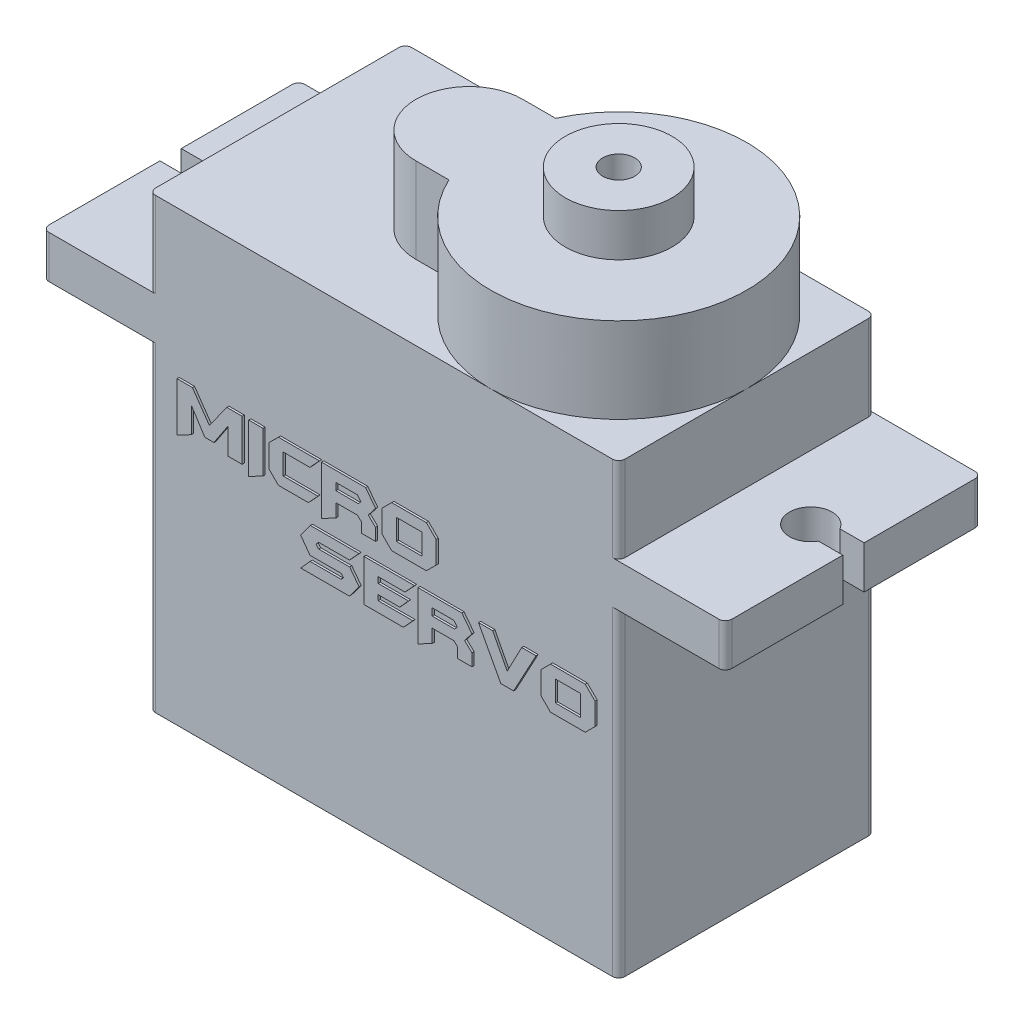
from build123d import *

# Parameters (mm, degrees)
SKETCH1_W           = 32
SKETCH1_H           = 12
BOSS_EXTRUDE1_DEPTH = 2
SKETCH2_W           = 22
SKETCH2_H           = 12
BOSS_EXTRUDE2_DEPTH = 15
SKETCH3_W           = 22
SKETCH3_H           = 12
BOSS_EXTRUDE3_DEPTH = 4
SKETCH4_R           = 6
BOSS_EXTRUDE4_DEPTH = 4
BOSS_EXTRUDE5_DEPTH = 4
SKETCH6_R           = 2.5
SKETCH6_R_2         = 0.75
BOSS_EXTRUDE6_DEPTH = 2
SKETCH7_R           = 1
SKETCH7_W           = 5
SKETCH7_H           = 1
CUT_EXTRUDE1_DEPTH  = 25.103941586
FILLET1_R           = 0.3
SKETCH8_W           = 1.18990991
SKETCH8_H           = 0.976336336
SKETCH8_H_2         = 0.976336337
BOSS_EXTRUDE7_DEPTH = 0.1


with BuildPart() as part:
    # Sketch1 → Boss-Extrude1 (new body)
    with BuildSketch(Plane(origin=(0, 0, 0), x_dir=(1, 0, 0), z_dir=(0, 1, 0))):
        Rectangle(SKETCH1_W, SKETCH1_H)
    extrude(amount=BOSS_EXTRUDE1_DEPTH)

    # Sketch2 → Boss-Extrude2 (add)
    with BuildSketch(Plane.XZ):
        Rectangle(SKETCH2_W, SKETCH2_H)
    extrude(amount=BOSS_EXTRUDE2_DEPTH)

    # Sketch3 → Boss-Extrude3 (add)
    with BuildSketch(Plane(origin=(0, 2, 0), x_dir=(1, 0, 0), z_dir=(0, 1, 0))):
        Rectangle(SKETCH3_W, SKETCH3_H)
    extrude(amount=BOSS_EXTRUDE3_DEPTH)

    # Sketch4 → Boss-Extrude4 (add)
    with BuildSketch(Plane(origin=(0, 6, 0), x_dir=(1, 0, 0), z_dir=(0, 1, 0))):
        with Locations((5, 0)):
            Circle(SKETCH4_R)
    extrude(amount=BOSS_EXTRUDE4_DEPTH)

    # Sketch5 → Boss-Extrude5 (add)
    with BuildSketch(Plane(origin=(0, 6, 0), x_dir=(1, 0, 0), z_dir=(0, 1, 0))):
        with BuildLine():
            ThreePointArc((-1, 0), (-0.862002062, 1.279426367), (-0.454356057, 2.5))
            Line((-0.454356057, 2.5), (-2, 2.5))
            ThreePointArc((-2, 2.5), (-4.5, 0), (-2, -2.5))
            Line((-2, -2.5), (-0.454356057, -2.5))
            ThreePointArc((-0.454356057, -2.5), (-0.862002062, -1.279426367), (-1, 0))
        make_face()
    extrude(amount=BOSS_EXTRUDE5_DEPTH)

    # Sketch6 → Boss-Extrude6 (add)
    with BuildSketch(Plane(origin=(0, 10, 0), x_dir=(1, 0, 0), z_dir=(0, 1, 0))):
        with Locations((5, 0)):
            Circle(SKETCH6_R)
        with Locations((5, 0)):
            Circle(SKETCH6_R_2, mode=Mode.SUBTRACT)
    extrude(amount=BOSS_EXTRUDE6_DEPTH)

    # Sketch7 → Cut-Extrude1 (cut, through all)
    with BuildSketch(Plane(origin=(0, 2, 0), x_dir=(1, 0, 0), z_dir=(0, 1, 0))):
        with Locations((14, 0)):
            Circle(SKETCH7_R)
        with Locations((-14, 0)):
            Circle(SKETCH7_R)
        with Locations((16, 0)):
            Rectangle(SKETCH7_W, SKETCH7_H)
        with Locations((-16, 0)):
            Rectangle(SKETCH7_W, SKETCH7_H)
    extrude(amount=-CUT_EXTRUDE1_DEPTH, mode=Mode.SUBTRACT)

    # Fillet1
    fillet1_edges = [part.edges().sort_by_distance(p)[0] for p in [
        (11, 4, -6),
        (11, -7.5, -6),
        (11, 4, 6),
        (11, -7.5, 6),
        (-11, 4, -6),
        (-11, 4, 6),
        (-11, -7.5, 6),
        (-11, -7.5, -6),
        (-16, 1, -6),
        (-16, 1, 6),
        (16, 1, -6),
        (16, 1, 6),
    ]]
    fillet(fillet1_edges, radius=FILLET1_R)

    # Sketch8 → Boss-Extrude7 (add)
    # profile 1 of 10: a face of its own
    with BuildSketch(Plane.XY.offset(6)):
        Polygon((-6.546228955, -2.789688189), (-7.217460186, -2.789688189), (-7.217460186, -1.581662663), (-7.868192168, -2.564673174), (-8.295339315, -2.564673174), (-8.926048774, -1.582616117), (-8.926048774, -2.775386387), (-9.597280006, -3.125303805), (-9.597280006, -0.837015516), (-8.876469195, -0.837015516), (-8.079858834, -1.98115966), (-7.268469946, -0.837015516), (-6.546228955, -0.837015516), align=None)
    # profile 2 of 10: a face of its own
    with BuildSketch(Plane.XY.offset(6)):
        Polygon((-5.569892618, -2.778246748), (-6.241123849, -3.125303805), (-6.241123849, -0.837015516), (-5.569892618, -0.837015516), align=None)
    # profile 3 of 10: a face of its own
    with BuildSketch(Plane.XY.offset(6)):
        Polygon((-2.923582558, -0.837015516), (-3.373135861, -1.325183685), (-4.624066792, -1.325183685), (-4.624066792, -2.301520021), (-2.99175448, -2.301520021), (-3.445121597, -2.789688189), (-4.84431454, -2.789688189), (-5.295298024, -2.344902153), (-5.295298024, -1.285138639), (-4.84431454, -0.837015516), align=None)
    # profile 4 of 10: a face of its own
    with BuildSketch(Plane.XY.offset(6)):
        Polygon((-0.2915743, -2.789688189), (-0.962805531, -2.789688189), (-0.962805531, -2.31772873), (-1.138717693, -2.148967468), (-2.152715441, -2.148967468), (-2.152715441, -2.770142393), (-2.823946672, -3.125303805), (-2.823946672, -0.837015516), (-0.762580306, -0.837015516), (-0.2915743, -1.45103954), (-0.63672445, -1.892488489), (-0.2915743, -2.219999751), align=None)
        Polygon((-0.981397873, -1.52397873), (-1.143008234, -1.325183685), (-2.152715441, -1.325183685), (-2.152715441, -1.6607993), (-1.096765741, -1.6607993), align=None, mode=Mode.SUBTRACT)
    # profile 5 of 10: a face of its own
    with BuildSketch(Plane.XY.offset(6)):
        Polygon((2.545903178, -2.332507258), (2.08824552, -2.789688189), (0.461653928, -2.789688189), (0.013530805, -2.342041793), (0.013530805, -1.285138639), (0.462130655, -0.837015516), (2.087768793, -0.837015516), (2.545903178, -1.294673174), align=None)
        with Locations((1.279716991, -1.813351853)):
            Rectangle(SKETCH8_W, SKETCH8_H, mode=Mode.SUBTRACT)
    # profile 6 of 10: a face of its own
    with BuildSketch(Plane.XY.offset(6)):
        Polygon((-1.064397577, -5.019272635), (-1.519194874, -5.623285398), (-3.801285715, -5.623285398), (-3.361266946, -5.13511723), (-1.916784964, -5.13511723), (-1.799033463, -5.025946809), (-1.91154097, -4.891033146), (-3.366987667, -4.891033146), (-3.801285715, -4.292741103), (-3.352685865, -3.670612725), (-1.064397577, -3.670612725), (-1.517764694, -4.158780893), (-2.964153583, -4.158780893), (-3.079044724, -4.29178765), (-2.963200129, -4.433375488), (-1.507753433, -4.433375488), align=None)
    # profile 7 of 10: a face of its own
    with BuildSketch(Plane.XY.offset(6)):
        Polygon((1.52994927, -3.670612725), (1.080395967, -4.158780893), (-0.170534964, -4.158780893), (-0.170534964, -4.433375488), (1.251540862, -4.433375488), (0.837265336, -4.891033146), (-0.170534964, -4.891033146), (-0.170534964, -5.13511723), (1.461777348, -5.13511723), (1.008410231, -5.623285398), (-0.841766195, -5.623285398), (-0.841766195, -3.670612725), align=None)
    # profile 8 of 10: a face of its own
    with BuildSketch(Plane.XY.offset(6)):
        Polygon((4.222978549, -5.623285398), (3.551747318, -5.623285398), (3.551747318, -5.151325938), (3.375835156, -4.982564677), (2.361837408, -4.982564677), (2.361837408, -5.603739602), (1.690606177, -5.958901013), (1.690606177, -3.670612725), (3.751972543, -3.670612725), (4.222978549, -4.284636749), (3.877828399, -4.726085698), (4.222978549, -5.053596959), align=None)
        Polygon((3.533154976, -4.357575938), (3.371544615, -4.158780893), (2.361837408, -4.158780893), (2.361837408, -4.494396509), (3.417787108, -4.494396509), align=None, mode=Mode.SUBTRACT)
    # profile 9 of 10: a face of its own
    with BuildSketch(Plane.XY.offset(6)):
        Polygon((7.226356928, -3.670612725), (6.175174495, -5.623285398), (5.574975546, -5.623285398), (4.528083654, -3.670612725), (5.194070892, -3.670612725), (5.874836657, -4.972553416), (6.555602423, -3.670612725), align=None)
    # profile 10 of 10: a face of its own
    with BuildSketch(Plane.XY.offset(6)):
        Polygon((9.989465036, -5.166104467), (9.531807378, -5.623285398), (7.905215787, -5.623285398), (7.457092663, -5.175639001), (7.457092663, -4.118735848), (7.905692513, -3.670612725), (9.531330651, -3.670612725), (9.989465036, -4.128270383), align=None)
        with Locations((8.72327885, -4.646949062)):
            Rectangle(SKETCH8_W, SKETCH8_H_2, mode=Mode.SUBTRACT)
    extrude(amount=BOSS_EXTRUDE7_DEPTH)


solid = part.part
